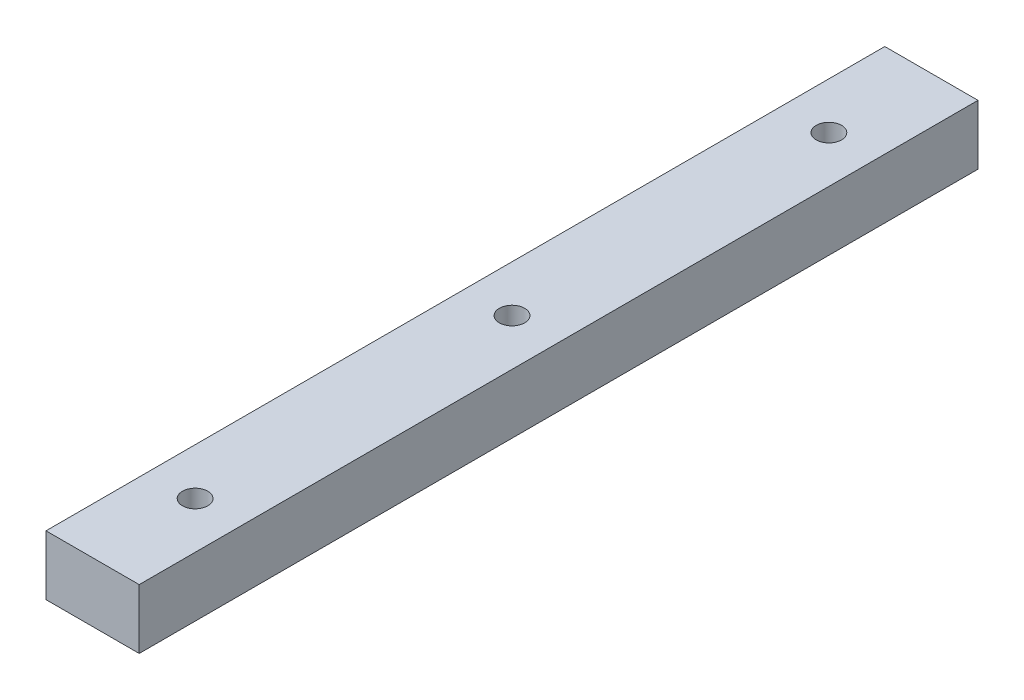
from build123d import *

# Parameters (mm, degrees)
SKETCH1_W           = 25
SKETCH1_H           = 225
BOSS_EXTRUDE1_DEPTH = 16
SKETCH2_R           = 8.5
CUT_EXTRUDE1_DEPTH  = 5
M8_TAPPED_HOLE1_D   = 6.8


with BuildPart() as part:
    # Sketch1 → Boss-Extrude1 (new body)
    with BuildSketch(Plane(origin=(0, 0, 0), x_dir=(1, 0, 0), z_dir=(0, 1, 0))):
        Rectangle(SKETCH1_W, SKETCH1_H)
    extrude(amount=-BOSS_EXTRUDE1_DEPTH)

    # Sketch2 → Cut-Extrude1 (cut)
    with BuildSketch(Plane.XZ.offset(16)):
        with Locations((0, 100)):
            Circle(SKETCH2_R)
        with Locations((0, -100)):
            Circle(SKETCH2_R)
    extrude(amount=-CUT_EXTRUDE1_DEPTH, mode=Mode.SUBTRACT)

    # M8 Tapped Hole1 (through all)
    with Locations(Plane(origin=(0, 0, 0), x_dir=(1, 0, 0), z_dir=(0, 1, 0))):
        with Locations((0, 85), (0, 0), (0, -85)):
            Hole(M8_TAPPED_HOLE1_D / 2)


solid = part.part
